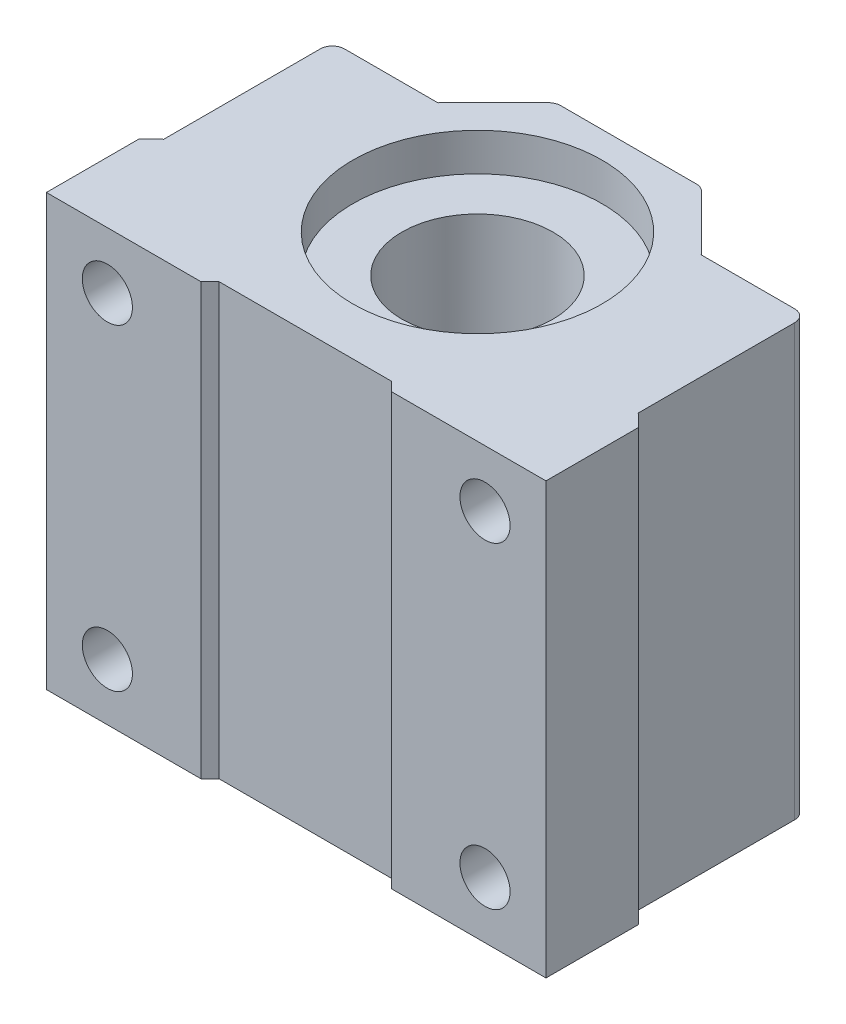
from build123d import *

# Parameters (mm, degrees)
SKETCH1_R           = 6.35
BOSS_EXTRUDE1_DEPTH = 36.195
CHAMFER1_SIZE       = 4.92
CHAMFER2_SIZE       = 1.016
FILLET1_R           = 1.016
SKETCH2_R           = 10.4775
CUT_EXTRUDE1_DEPTH  = 3.175
CUT_EXTRUDE2_START  = -3.175
SKETCH3_R           = 10.4775
CUT_EXTRUDE2_DEPTH  = 3.175
SKETCH4_R           = 2.1082
CUT_EXTRUDE3_DEPTH  = 29.337
CHAMFER3_SIZE       = 1.016


with BuildPart() as part:
    # Sketch1 → Boss-Extrude1 (new body)
    with BuildSketch(Plane(origin=(0, 0, 0), x_dir=(1, 0, 0), z_dir=(0, 1, 0))):
        Polygon((-21, -13.97), (-6.985, -13.97), (-6.985, -13.208), (6.985, -13.208), (6.985, -13.97), (21, -13.97), (21, -5.194), (19.939, -5.194), (19.939, 9.011817488), (11.049, 9.011817488), (11.049, 13.97), (-11.049, 13.97), (-11.049, 9.011817488), (-19.939, 9.011817488), (-19.939, -5.194), (-21, -5.194), align=None)
        with Locations(Location((0, 1.27, 0), (0, 0, 270))):
            Circle(SKETCH1_R, mode=Mode.SUBTRACT)
    extrude(amount=BOSS_EXTRUDE1_DEPTH)

    # Chamfer1
    chamfer1_edges = [part.edges().sort_by_distance(p)[0] for p in [
        (-11.049, 18.0975, -13.97),
        (11.049, 18.0975, -13.97),
    ]]
    chamfer(chamfer1_edges, length=CHAMFER1_SIZE)

    # Chamfer2
    # the kernel refuses this chamfer: 1.016 mm, written as the material it takes off along each edge
    with BuildSketch(Plane(origin=(6.985, -2.612829916, 13.97), x_dir=(0.9996219169112968, 0, 0.027495876610587285), z_dir=(0, 1, 0))) as chamfer2_piece_1_section:
        Polygon((CHAMFER2_SIZE * 0.999621916911, CHAMFER2_SIZE * 0.0274958766106), (-CHAMFER2_SIZE * 0.0274958766106, CHAMFER2_SIZE * 0.999621916911), (0, 0), align=None)
    chamfer2_piece_1 = extrude(amount=41.420659832, mode=Mode.PRIVATE)
    chamfer2_piece_1 = split(chamfer2_piece_1, bisect_by=Plane(origin=(7.342590456, 18.0975, 13.208), z_dir=(0, 0, 1)), keep=Keep.TOP, mode=Mode.PRIVATE)
    add(chamfer2_piece_1, mode=Mode.SUBTRACT)
    with BuildSketch(Plane(origin=(-6.985, -2.612829916, 13.97), x_dir=(0.027495876610586455, 0, -0.9996219169112968), z_dir=(0, 1, 0))) as chamfer2_piece_2_section:
        Polygon((CHAMFER2_SIZE * 0.999621916911, CHAMFER2_SIZE * 0.0274958766106), (-CHAMFER2_SIZE * 0.0274958766106, CHAMFER2_SIZE * 0.999621916911), (0, 0), align=None)
    chamfer2_piece_2 = extrude(amount=41.420659832, mode=Mode.PRIVATE)
    chamfer2_piece_2 = split(chamfer2_piece_2, bisect_by=Plane(origin=(-7.342590456, 18.0975, 13.208), z_dir=(0, 0, 1)), keep=Keep.TOP, mode=Mode.PRIVATE)
    add(chamfer2_piece_2, mode=Mode.SUBTRACT)
    with BuildSketch(Plane(origin=(-21, -2.612829916, 5.194), x_dir=(0.9996219169112968, 0, -0.02749587661058551), z_dir=(0, 1, 0))) as chamfer2_piece_3:
        Polygon((CHAMFER2_SIZE * 0.999621916911, -CHAMFER2_SIZE * 0.0274958766106), (-CHAMFER2_SIZE * 0.0274958766106, -CHAMFER2_SIZE * 0.999621916911), (0, 0), align=None)
    extrude(amount=41.420659832, mode=Mode.SUBTRACT)
    with BuildSketch(Plane(origin=(21, -2.612829916, 5.194), x_dir=(-0.9996219169112968, 0, -0.027495876610584665), z_dir=(0, 1, 0))) as chamfer2_piece_4:
        Polygon((CHAMFER2_SIZE * 0.999621916911, CHAMFER2_SIZE * 0.0274958766106), (-CHAMFER2_SIZE * 0.0274958766106, CHAMFER2_SIZE * 0.999621916911), (0, 0), align=None)
    extrude(amount=41.420659832, mode=Mode.SUBTRACT)

    # Fillet1
    fillet1_edges = [part.edges().sort_by_distance(p)[0] for p in [
        (-19.939, 18.0975, -9.011817488),
        (19.939, 18.0975, -9.011817488),
        (-6.129, 18.0975, -13.97),
        (6.129, 18.0975, -13.97),
    ]]
    fillet(fillet1_edges, radius=FILLET1_R)

    # Sketch2 → Cut-Extrude1 (cut)
    with BuildSketch(Plane(origin=(0, 36.195, 0), x_dir=(1, 0, 0), z_dir=(0, 1, 0))):
        with Locations(Location((0, 1.27, 0), (0, 0, 270))):
            Circle(SKETCH2_R)
    extrude(amount=-CUT_EXTRUDE1_DEPTH, mode=Mode.SUBTRACT)

    # Sketch3 → Cut-Extrude2 (cut)
    with BuildSketch(Plane.XZ.offset(CUT_EXTRUDE2_START)):
        with Locations(Location((0, -1.27, 0), (0, 0, 90))):
            Circle(SKETCH3_R)
    extrude(amount=CUT_EXTRUDE2_DEPTH, mode=Mode.SUBTRACT)

    # Sketch4 → Cut-Extrude3 (cut)
    with BuildSketch(Plane(origin=(0, 0, -9.011817488), x_dir=(-1, 0, 0), z_dir=(0, 0, -1))):
        with Locations((-15.875, 4.7625)):
            Circle(SKETCH4_R)
        with Locations((-15.875, 31.4325)):
            Circle(SKETCH4_R)
        with Locations((15.875, 31.4325)):
            Circle(SKETCH4_R)
        with Locations((15.875, 4.7625)):
            Circle(SKETCH4_R)
    extrude(amount=-CUT_EXTRUDE3_DEPTH, mode=Mode.SUBTRACT)

    # Chamfer3
    # the kernel refuses this chamfer: 1.016 mm, written as the material it takes off along each edge
    with BuildSketch(Plane(origin=(-15.875, 4.7625, -9.011817488), x_dir=(-1, 0, 0), z_dir=(0, -1, 0))) as chamfer3_piece_1:
        Polygon((2.1082 + CHAMFER3_SIZE, 0), (2.1082, -CHAMFER3_SIZE), (2.1082, 0), align=None)
    revolve(axis=Axis((-15.875, 4.7625, -9.011817488), (0, 0, -1)), mode=Mode.SUBTRACT)
    with BuildSketch(Plane(origin=(-15.875, 31.4325, -9.011817488), x_dir=(-1, 0, 0), z_dir=(0, -1, 0))) as chamfer3_piece_2:
        Polygon((2.1082 + CHAMFER3_SIZE, 0), (2.1082, -CHAMFER3_SIZE), (2.1082, 0), align=None)
    revolve(axis=Axis((-15.875, 31.4325, -9.011817488), (0, 0, -1)), mode=Mode.SUBTRACT)
    with BuildSketch(Plane(origin=(15.875, 31.4325, -9.011817488), x_dir=(-1, 0, 0), z_dir=(0, -1, 0))) as chamfer3_piece_3:
        Polygon((2.1082 + CHAMFER3_SIZE, 0), (2.1082, -CHAMFER3_SIZE), (2.1082, 0), align=None)
    revolve(axis=Axis((15.875, 31.4325, -9.011817488), (0, 0, -1)), mode=Mode.SUBTRACT)
    with BuildSketch(Plane(origin=(15.875, 4.7625, -9.011817488), x_dir=(-1, 0, 0), z_dir=(0, -1, 0))) as chamfer3_piece_4:
        Polygon((2.1082 + CHAMFER3_SIZE, 0), (2.1082, -CHAMFER3_SIZE), (2.1082, 0), align=None)
    revolve(axis=Axis((15.875, 4.7625, -9.011817488), (0, 0, -1)), mode=Mode.SUBTRACT)


solid = part.part
